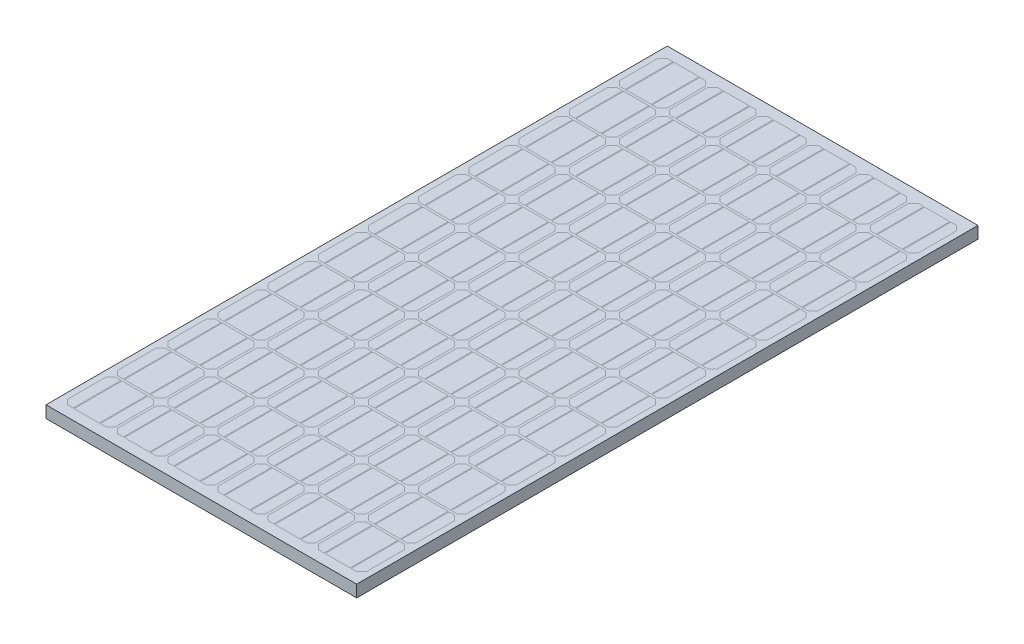
from build123d import *

# Parameters (mm, degrees)
SKETCH1_W           = 990.6
SKETCH1_H           = 1981.2
BOSS_EXTRUDE1_DEPTH = 38.1


with BuildPart() as part:
    # Sketch1 → Boss-Extrude1 (new body)
    with BuildSketch(Plane(origin=(0, 0, 0), x_dir=(1, 0, 0), z_dir=(0, 1, 0))):
        Rectangle(SKETCH1_W, SKETCH1_H)
    extrude(amount=BOSS_EXTRUDE1_DEPTH)


solid = part.part
